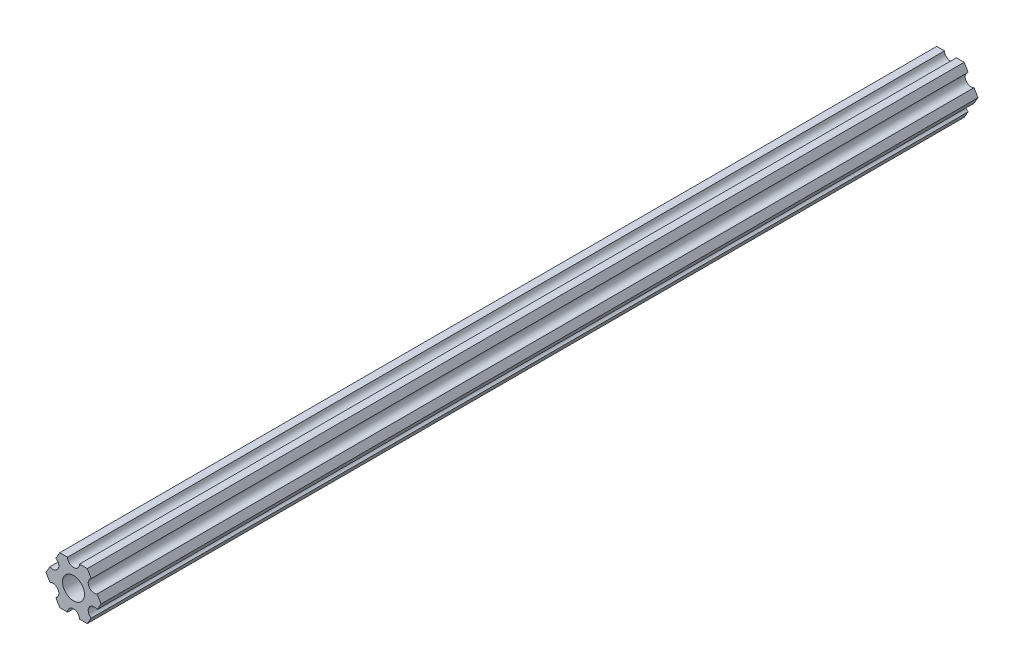
from build123d import *

# Parameters (mm, degrees)
SKETCH1_R           = 2.9337
BOSS_EXTRUDE1_DEPTH = 233.6165


with BuildPart() as part:
    # Sketch1 → Boss-Extrude1 (new body)
    with BuildSketch(Plane.XY):
        with BuildLine():
            Line((-4.70551159, -4.549815043), (-3.666174521, -6.349999904))
            Line((-3.666174521, -6.349999904), (-1.587501154, -6.349999904))
            ThreePointArc((-1.587501154, -6.349999904), (-3.85e-07, -4.762499134), (1.587501154, -6.349999904))
            Line((1.587501154, -6.349999904), (3.666173825, -6.349999904))
            Line((3.666173825, -6.349999904), (4.705510929, -4.549815232))
            ThreePointArc((4.705510929, -4.549815232), (4.124445601, -2.381249904), (6.293010929, -1.800184575))
            Line((6.293010929, -1.800184575), (7.332348034, 9.6e-08))
            Line((7.332348034, 9.6e-08), (6.293011178, 1.800184715))
            ThreePointArc((6.293011178, 1.800184715), (4.124445902, 2.381250241), (4.705511428, 4.549815516))
            Line((4.705511428, 4.549815516), (3.666174521, 6.350000222))
            Line((3.666174521, 6.350000222), (1.587498846, 6.350000222))
            ThreePointArc((1.587498846, 6.350000222), (3.85e-07, 4.762501761), (-1.587498846, 6.350000222))
            Line((-1.587498846, 6.350000222), (-3.666173825, 6.350000222))
            Line((-3.666173825, 6.350000222), (-4.705511038, 4.549815614))
            ThreePointArc((-4.705511038, 4.549815614), (-4.124445841, 2.38125025), (-6.293011205, 1.800185053))
            Line((-6.293011205, 1.800185053), (-7.332348419, 4.44e-07))
            Line((-7.332348419, 4.44e-07), (-6.293011423, -1.80018429))
            ThreePointArc((-6.293011423, -1.80018429), (-4.12444613, -2.38124975), (-4.70551159, -4.549815043))
        make_face()
        Circle(SKETCH1_R, mode=Mode.SUBTRACT)
    extrude(amount=-BOSS_EXTRUDE1_DEPTH)


solid = part.part
